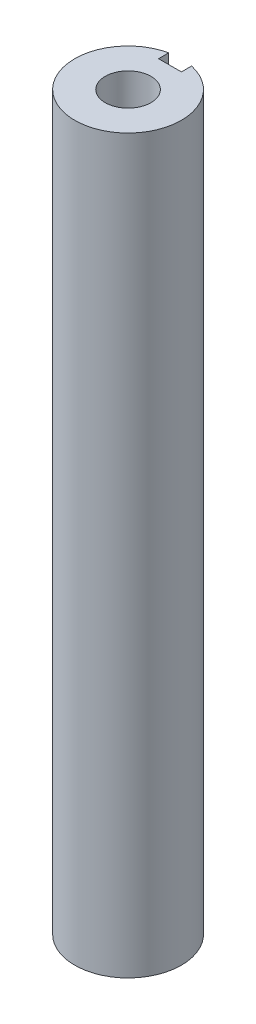
from build123d import *

# Parameters (mm, degrees)
SKETCH1_R   = 4.7625
SHAFT_DEPTH = 152.4


with BuildPart() as part:
    # Sketch1 → Shaft (new body)
    with BuildSketch(Plane(origin=(0, 0, 0), x_dir=(1, 0, 0), z_dir=(0, 1, 0))):
        with BuildLine():
            Line((-2.38125, 10.854368), (-2.38125, 8.73125))
            Line((-2.38125, 8.73125), (2.38125, 8.73125))
            Line((2.38125, 8.73125), (2.38125, 10.854368))
            ThreePointArc((2.38125, 10.854368), (0, -11.1125), (-2.38125, 10.854368))
        make_face()
        Circle(SKETCH1_R, mode=Mode.SUBTRACT)
    extrude(amount=SHAFT_DEPTH)


solid = part.part
